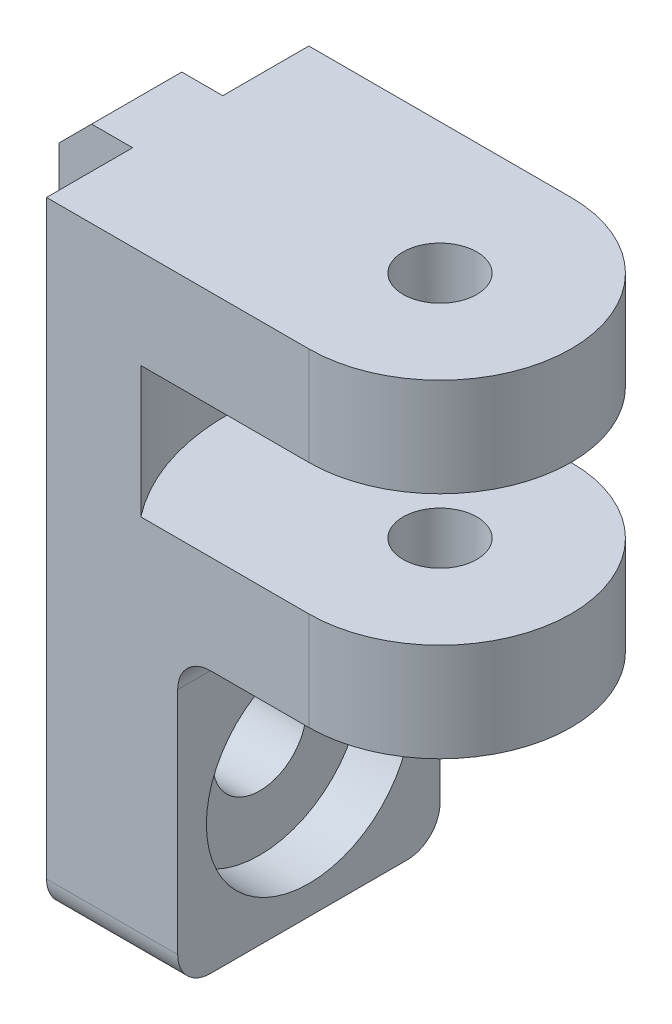
from build123d import *

# Parameters (mm, degrees)
SKETCH1_W           = 16
SKETCH1_H           = 38
BOSS_EXTRUDE1_DEPTH = 8
SKETCH2_W           = 5.5
SKETCH2_H           = 22
BOSS_EXTRUDE2_DEPTH = 4.5
SKETCH6_R           = 2.25
BOSS_EXTRUDE3_DEPTH = 20
FILLET6_R           = 2
CHAMFER1_SIZE       = 2
SKETCH7_R           = 2.85
CUT_EXTRUDE1_DEPTH  = 10
SKETCH8_R           = 6.25
CUT_EXTRUDE2_DEPTH  = 3
CUT_EXTRUDE3_START  = -10
SKETCH9_R           = 13
CUT_EXTRUDE3_DEPTH  = 4
FILLET7_R           = 2


with BuildPart() as part:
    # Sketch1 → Boss-Extrude1 (new body)
    with BuildSketch(Plane(origin=(0, 0, 0), x_dir=(0, 0, -1), z_dir=(1, 0, 0))):
        with Locations((-40.846556001, 16.91146402)):
            Rectangle(SKETCH1_W, SKETCH1_H)
    extrude(amount=BOSS_EXTRUDE1_DEPTH)

    # Sketch2 → Boss-Extrude2 (add)
    with BuildSketch(Plane.ZY):
        with Locations((40.846556001, 24.91146402)):
            Rectangle(SKETCH2_W, SKETCH2_H)
    extrude(amount=BOSS_EXTRUDE2_DEPTH)

    # Sketch6 → Boss-Extrude3 (add)
    with BuildSketch(Plane.XZ.offset(-35.91146402)):
        with BuildLine():
            Line((8, 48.846556001), (16, 48.846556001))
            ThreePointArc((16, 48.846556001), (24, 40.846556001), (16, 32.846556001))
            Line((16, 32.846556001), (8, 32.846556001))
            Line((8, 32.846556001), (8, 48.846556001))
        make_face()
        with Locations((16, 40.846556001)):
            Circle(SKETCH6_R, mode=Mode.SUBTRACT)
    extrude(amount=BOSS_EXTRUDE3_DEPTH)

    # Fillet6
    fillet6_edges = [part.edges().sort_by_distance(p)[0] for p in [
        (8, 15.91146402, 40.846556001),
    ]]
    fillet(fillet6_edges, radius=FILLET6_R)

    # Chamfer1
    chamfer1_edges = [part.edges().sort_by_distance(p)[0] for p in [
        (-4.5, 13.91146402, 40.846556001),
        (-4.5, 35.91146402, 40.846556001),
    ]]
    chamfer(chamfer1_edges, length=CHAMFER1_SIZE)

    # Sketch7 → Cut-Extrude1 (cut)
    with BuildSketch(Plane(origin=(8, 0, 0), x_dir=(0, 0, -1), z_dir=(1, 0, 0))):
        with Locations((-40.846556001, 5.91146402)):
            Circle(SKETCH7_R)
    extrude(amount=-CUT_EXTRUDE1_DEPTH, mode=Mode.SUBTRACT)

    # Sketch8 → Cut-Extrude2 (cut)
    with BuildSketch(Plane(origin=(8, 0, 0), x_dir=(0, 0, -1), z_dir=(1, 0, 0))):
        with Locations((-40.846556001, 5.91146402)):
            Circle(SKETCH8_R)
    extrude(amount=-CUT_EXTRUDE2_DEPTH, mode=Mode.SUBTRACT)

    # Sketch9 → Cut-Extrude3 (cut, symmetric)
    with BuildSketch(Plane(origin=(0, 35.91146402, 0), x_dir=(1, 0, 0), z_dir=(0, 1, 0)).offset(CUT_EXTRUDE3_START)):
        with Locations((16, -40.846556001)):
            Circle(SKETCH9_R)
    extrude(amount=CUT_EXTRUDE3_DEPTH, both=True, mode=Mode.SUBTRACT)

    # Fillet7
    fillet7_edges = [part.edges().sort_by_distance(p)[0] for p in [
        (4, -2.08853598, 32.846556001),
        (4, -2.08853598, 48.846556001),
    ]]
    fillet(fillet7_edges, radius=FILLET7_R)


solid = part.part
